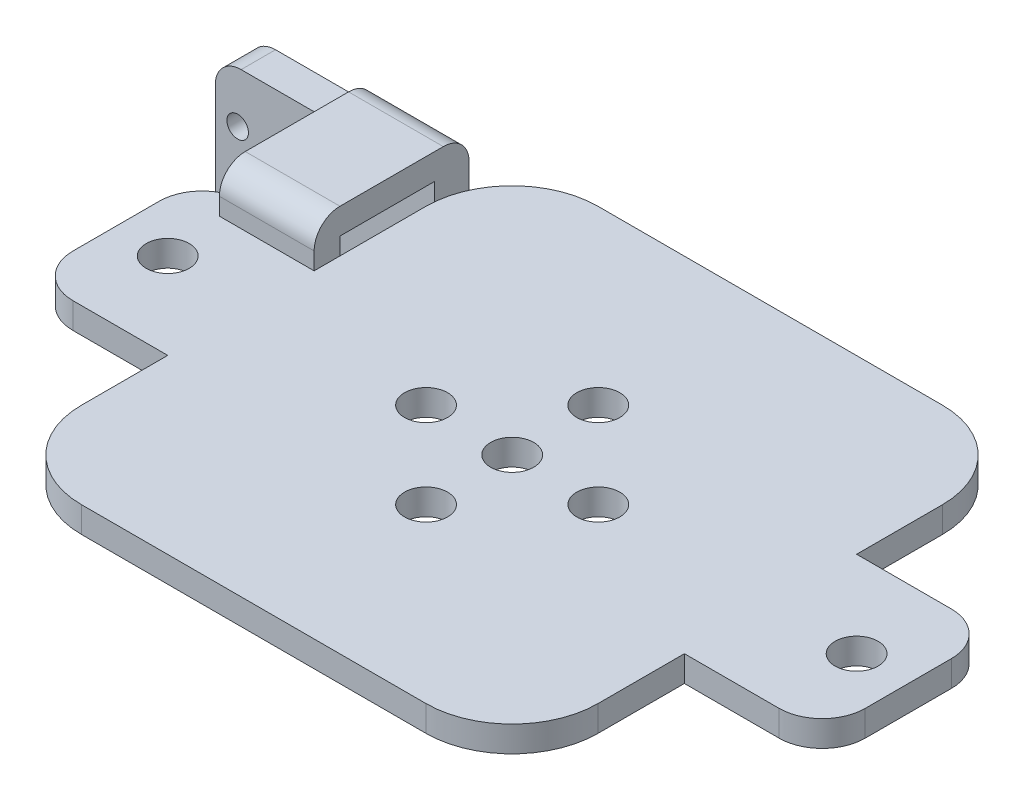
from build123d import *

# Parameters (mm, degrees)
SKETCH1_W               = 60
SKETCH1_H               = 60
SKETCH1_R               = 2.5
BOSS_EXTRUDE2_DEPTH     = 5
SKETCH3_W               = 35
SKETCH3_H               = 20
BOSS_EXTRUDE3_DEPTH     = 5
SKETCH5_R               = 2.5
CUT_EXTRUDE1_DEPTH      = 113.472218792
FILLET1_R               = 10
FILLET2_R               = 10
FILLET3_R               = 10
CUT_EXTRUDE2_DEPTH      = 113.472218792
CUT_EXTRUDE2_DEPTH_BACK = 113.472218792
SKETCH6_W               = 130
SKETCH6_H               = 2
CUT_EXTRUDE4_DEPTH      = 113.401067611
CUT_EXTRUDE4_DEPTH_BACK = 113.401067611
FILLET4_R               = 5
SKETCH8_W               = 11
SKETCH8_H               = 5
BOSS_EXTRUDE4_DEPTH     = 3
SKETCH9_W               = 11
SKETCH9_H               = 3
BOSS_EXTRUDE5_DEPTH     = 15
BOSS_EXTRUDE6_DEPTH     = 21
CUT_EXTRUDE5_DEPTH      = 93.926839714
CUT_EXTRUDE5_DEPTH_BACK = 10
SKETCH11_R              = 1.25
FILLET5_R               = 3


with BuildPart() as part:
    # Sketch1 → Boss-Extrude2 (new body)
    with BuildSketch(Plane(origin=(0, 0, 0), x_dir=(1, 0, 0), z_dir=(0, 1, 0))):
        with Locations((30, 30)):
            Rectangle(SKETCH1_W, SKETCH1_H)
        with Locations(Location((30, 40.020691429, 0), (0, 0, 270))):
            Circle(SKETCH1_R, mode=Mode.SUBTRACT)
        with Locations(Location((20, 30.020691429, 0), (0, 0, 270))):
            Circle(SKETCH1_R, mode=Mode.SUBTRACT)
        with Locations(Location((30, 20.020691429, 0), (0, 0, 270))):
            Circle(SKETCH1_R, mode=Mode.SUBTRACT)
        with Locations(Location((40, 30.020691429, 0), (0, 0, 270))):
            Circle(SKETCH1_R, mode=Mode.SUBTRACT)
        with Locations(Location((30, 30.020691429, 0), (0, 0, 270))):
            Circle(SKETCH1_R, mode=Mode.SUBTRACT)
    extrude(amount=BOSS_EXTRUDE2_DEPTH)

    # Sketch3 → Boss-Extrude3 (add)
    with BuildSketch(Plane(origin=(0, 0, 0), x_dir=(1, 0, 0), z_dir=(0, 1, 0))):
        with Locations((77.5, 30.020691429)):
            Rectangle(SKETCH3_W, SKETCH3_H)
        with Locations((-17.5, 30.020691429)):
            Rectangle(SKETCH3_W, SKETCH3_H)
    extrude(amount=BOSS_EXTRUDE3_DEPTH)

    # Sketch5 → Cut-Extrude1 (cut, through all)
    with BuildSketch(Plane(origin=(0, 0, 0), x_dir=(1, 0, 0), z_dir=(0, 1, 0))):
        with Locations(Location((70, 30.020691429, 0), (0, 0, 270))):
            Circle(SKETCH5_R)
        with Locations(Location((-10, 30.020691429, 0), (0, 0, 270))):
            Circle(SKETCH5_R)
    extrude(amount=CUT_EXTRUDE1_DEPTH, mode=Mode.SUBTRACT)

    # Fillet1
    fillet1_edges = [part.edges().sort_by_distance(p)[0] for p in [
        (95, 2.5, -20.020691429),
        (95, 2.5, -40.020691429),
    ]]
    fillet(fillet1_edges, radius=FILLET1_R - 0.0001)  # a hair under: the kernel refuses the full size

    # Fillet2
    fillet2_edges = [part.edges().sort_by_distance(p)[0] for p in [
        (-35, 2.5, -20.020691429),
        (-35, 2.5, -40.020691429),
    ]]
    fillet(fillet2_edges, radius=FILLET2_R - 0.0001)  # a hair under: the kernel refuses the full size

    # Fillet3
    fillet3_edges = [part.edges().sort_by_distance(p)[0] for p in [
        (0, 2.5, -60),
        (60, 2.5, -60),
        (60, 2.5, 0),
        (0, 2.5, 0),
    ]]
    fillet(fillet3_edges, radius=FILLET3_R)

    # Sketch6 → Cut-Extrude2 (cut, two sides: drawn at the far end of the back side and taken through both)
    with BuildSketch(Plane(origin=(0, 0, -60), x_dir=(-1, 0, 0), z_dir=(0, 0, -1)).offset(-CUT_EXTRUDE2_DEPTH_BACK)):
        with Locations((-30, 4)):
            Rectangle(SKETCH6_W, SKETCH6_H)
    extrude(amount=CUT_EXTRUDE2_DEPTH + CUT_EXTRUDE2_DEPTH_BACK, mode=Mode.SUBTRACT)

    # Sketch7 → Cut-Extrude4 (cut, two sides: drawn at the far end of the back side and taken through both)
    with BuildSketch(Plane(origin=(0, 3, 0), x_dir=(1, 0, 0), z_dir=(0, 1, 0)).offset(-CUT_EXTRUDE4_DEPTH_BACK)):
        Polygon((-16, 40.020691429), (-16, 42.339149427), (-38.923164287, 42.339149427), (-38.923164287, 39.725242292), (-38.923164287, 20.020691429), (-16, 20.020691429), align=None)
        Polygon((98.923164287, 20.020691429), (98.923164287, 39.725242292), (98.923164287, 44.006554538), (76, 44.006554538), (76, 40.020691429), (76, 20.020691429), align=None)
    extrude(amount=CUT_EXTRUDE4_DEPTH + CUT_EXTRUDE4_DEPTH_BACK, mode=Mode.SUBTRACT)

    # Fillet4
    fillet4_edges = [part.edges().sort_by_distance(p)[0] for p in [
        (-16, 1.5, -20.020691429),
        (-16, 1.5, -40.020691429),
        (76, 1.5, -40.020691429),
        (76, 1.5, -20.020691429),
    ]]
    fillet(fillet4_edges, radius=FILLET4_R)

    # Sketch8 → Boss-Extrude4 (add)
    with BuildSketch(Plane(origin=(0, 0, -40.020691429), x_dir=(-1, 0, 0), z_dir=(0, 0, -1))):
        with Locations((5.5, 5.5)):
            Rectangle(SKETCH8_W, SKETCH8_H)
    extrude(amount=-BOSS_EXTRUDE4_DEPTH)

    # Sketch9 → Boss-Extrude5 (add)
    with BuildSketch(Plane(origin=(0, 0, -40.020691429), x_dir=(-1, 0, 0), z_dir=(0, 0, -1))):
        with Locations((5.5, 6.5)):
            Rectangle(SKETCH9_W, SKETCH9_H)
    extrude(amount=BOSS_EXTRUDE5_DEPTH)

    # Sketch10 → Boss-Extrude6 (add)
    with BuildSketch(Plane.XZ.offset(-5)):
        Polygon((-25.480214152, -51.023499873), (-25.480214152, -55.020691429), (-11, -55.020691429), (0, -55.020691429), (0, -51.023499873), align=None)
    extrude(amount=BOSS_EXTRUDE6_DEPTH)

    # Sketch11 → Cut-Extrude5 (cut, two sides: drawn at the far end of the back side and taken through both)
    with BuildSketch(Plane.XY.offset(-51.023499873).offset(-CUT_EXTRUDE5_DEPTH_BACK)):
        with Locations(Location((-22.880182159, -0.931652135, 0), (0, 0, 180))):
            Circle(SKETCH11_R)
        with Locations(Location((-22.880182159, -10.431652135, 0), (0, 0, 180))):
            Circle(SKETCH11_R)
    extrude(amount=CUT_EXTRUDE5_DEPTH + CUT_EXTRUDE5_DEPTH_BACK, mode=Mode.SUBTRACT)

    # Fillet5
    fillet5_edges = [part.edges().sort_by_distance(p)[0] for p in [
        (-5.5, 8, -37.020691429),
        (-5.5, 8, -55.020691429),
        (0, -16, -53.022095651),
        (-25.480214152, 5, -53.022095651),
        (-25.480214152, -16, -53.022095651),
    ]]
    fillet(fillet5_edges, radius=FILLET5_R)


solid = part.part
